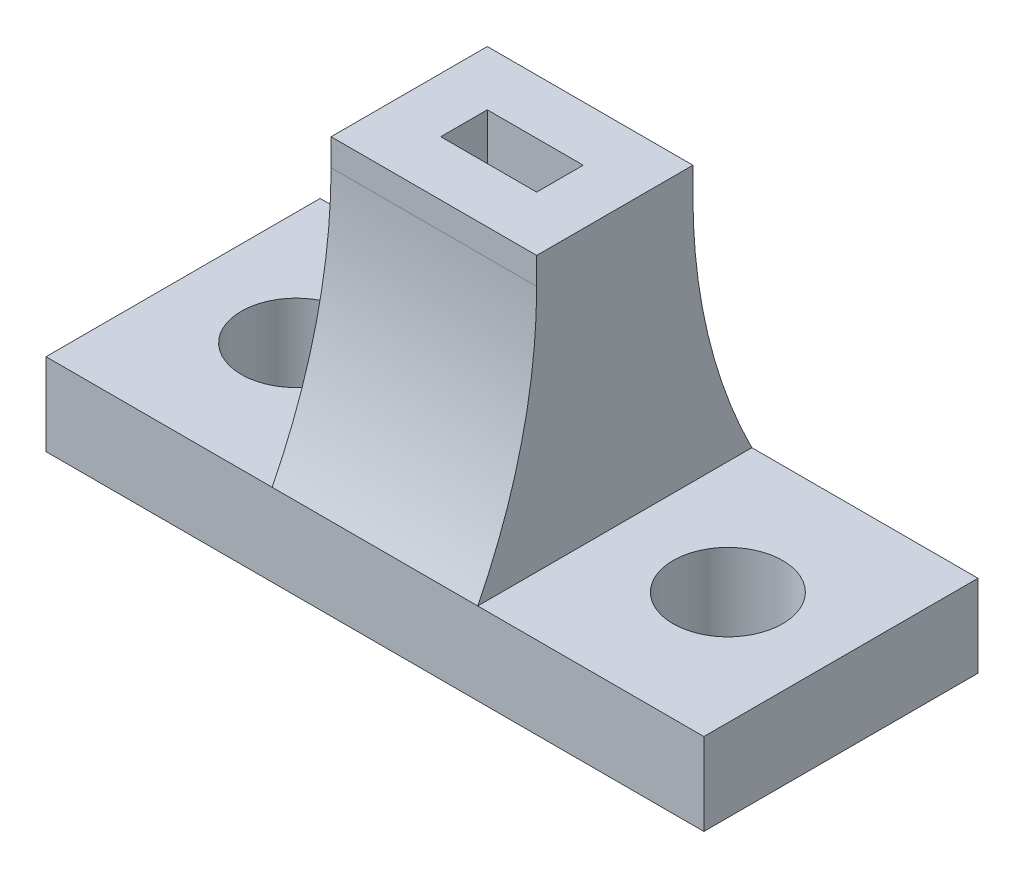
from build123d import *

# Parameters (mm, degrees)
SKETCH1_W           = 7.5
SKETCH1_H           = 5.7
SKETCH1_W_2         = 3.5
SKETCH1_H_2         = 1.7
BOSS_EXTRUDE1_DEPTH = 10
SKETCH2_W           = 24
SKETCH2_H           = 10
BOSS_EXTRUDE2_DEPTH = 3
FILLET1_R           = 20
SKETCH3_R           = 2
CUT_EXTRUDE1_DEPTH  = 3


with BuildPart() as part:
    # Sketch1 → Boss-Extrude1 (new body)
    with BuildSketch(Plane(origin=(0, 0, 0), x_dir=(1, 0, 0), z_dir=(0, 1, 0))):
        Rectangle(SKETCH1_W, SKETCH1_H)
        Rectangle(SKETCH1_W_2, SKETCH1_H_2, mode=Mode.SUBTRACT)
    extrude(amount=BOSS_EXTRUDE1_DEPTH)

    # Sketch2 → Boss-Extrude2 (add)
    with BuildSketch(Plane.XZ):
        Rectangle(SKETCH2_W, SKETCH2_H)
    extrude(amount=BOSS_EXTRUDE2_DEPTH)

    # Fillet1
    # the kernel refuses this fillet: 20 mm, written as the material it adds along each edge
    with BuildSketch(Plane(origin=(3.75, 0, 2.85), x_dir=(0, 0, 1), z_dir=(-1, 0, 0)), Plane(origin=(-3.75, 0, -2.85), x_dir=(0, 0, -1), z_dir=(1, 0, 0))) as fillet1_piece_1:
        with BuildLine():
            CenterArc((20, 9.020947844), FILLET1_R, 180, 26.810903424)
            Line((0, 9.020947844), (-0.4, 9.020947844))
            Line((-0.4, 9.020947844), (-0.4, 0))
            Line((-0.4, 0), (0, -0.4))
            ThreePointArc((0, -0.4), (1.075, -0.4), (1.793, -0.180418957))
            Line((1.793, -0.180418957), (2.15, 0))
        make_face()
    extrude(amount=7.5)

    # Sketch3 → Cut-Extrude1 (cut)
    with BuildSketch(Plane(origin=(0, 0, 0), x_dir=(1, 0, 0), z_dir=(0, 1, 0))):
        with Locations(Location((-7.875, 0, 0), (0, 0, 270))):
            Circle(SKETCH3_R)
        with Locations(Location((7.875, 0, 0), (0, 0, 270))):
            Circle(SKETCH3_R)
    extrude(amount=-CUT_EXTRUDE1_DEPTH, mode=Mode.SUBTRACT)


solid = part.part
